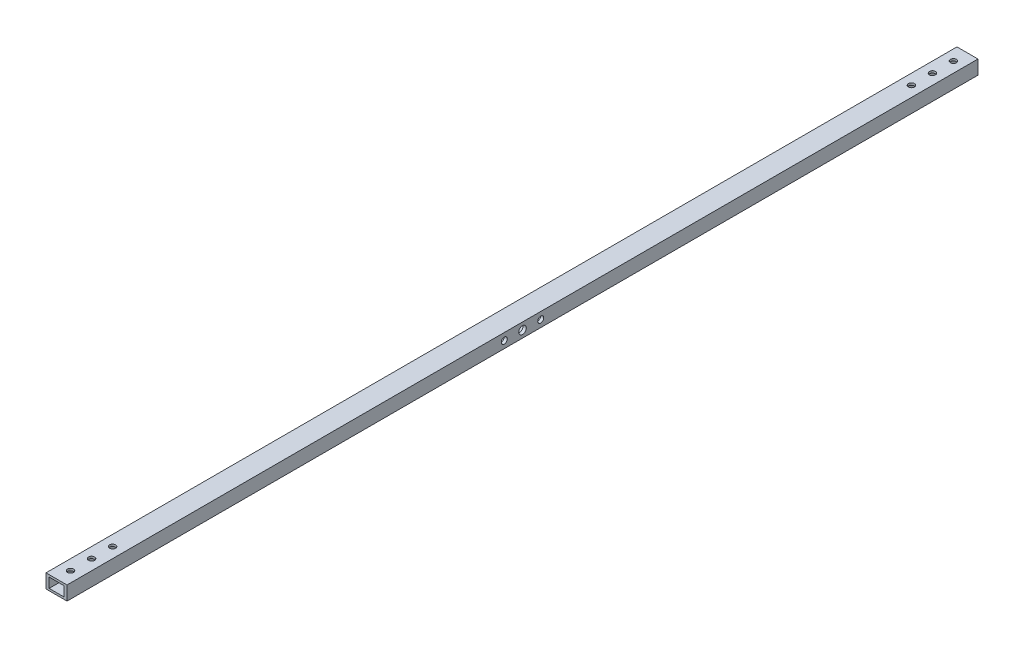
from build123d import *

# Parameters (mm, degrees)
SKETCH_1_W          = 15
SKETCH_1_H          = 10
SKETCH_1_W_2        = 10.5
SKETCH_1_H_2        = 7
EXTRUDE_1_DEPTH     = 650
SKETCH_2_R          = 2.15
CUT_EXTRUDE_1_DEPTH = 651.120181197
SKETCH_3_R          = 2.15
SKETCH_3_R_2        = 2.7
CUT_EXTRUDE_2_DEPTH = 651.192279253


with BuildPart() as part:
    # 草图1 → 凸台-拉伸1 (new body)
    with BuildSketch(Plane.XY):
        Rectangle(SKETCH_1_W, SKETCH_1_H)
        Rectangle(SKETCH_1_W_2, SKETCH_1_H_2, mode=Mode.SUBTRACT)
    extrude(amount=EXTRUDE_1_DEPTH)

    # 草图2 → 切除-拉伸1 (cut, through all)
    with BuildSketch(Plane.XZ.offset(5)):
        with Locations((0, 640)):
            Circle(SKETCH_2_R)
        with Locations((0, 625)):
            Circle(SKETCH_2_R)
        with Locations((0, 610)):
            Circle(SKETCH_2_R)
        with Locations((0, 40)):
            Circle(SKETCH_2_R)
        with Locations((0, 25)):
            Circle(SKETCH_2_R)
        with Locations((0, 10)):
            Circle(SKETCH_2_R)
    extrude(amount=-CUT_EXTRUDE_1_DEPTH, mode=Mode.SUBTRACT)

    # 草图3 → 切除-拉伸2 (cut, through all)
    with BuildSketch(Plane(origin=(7.5, 0, 0), x_dir=(0, 0, -1), z_dir=(1, 0, 0))):
        with Locations((-338, 0)):
            Circle(SKETCH_3_R)
        with Locations((-312, 0)):
            Circle(SKETCH_3_R)
        with Locations((-325, 0)):
            Circle(SKETCH_3_R_2)
    extrude(amount=-CUT_EXTRUDE_2_DEPTH, mode=Mode.SUBTRACT)


solid = part.part
